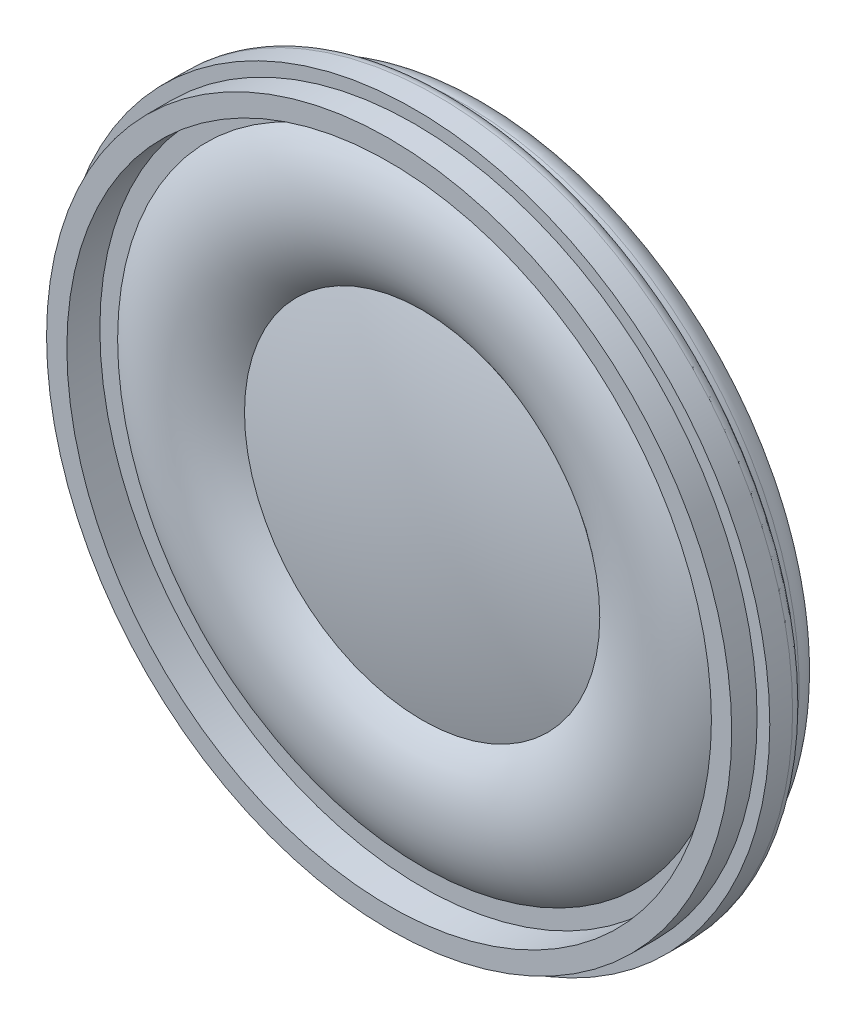
from build123d import *

# Parameters (mm, degrees)
EXTRUDE_2_DEPTH = 0.4
SKETCH_4_W      = 2.615384616
SKETCH_4_H      = 0.512820512
EXTRUDE_3_DEPTH = 0.01


with BuildPart() as part:
    # Эскиз1 → Повернуть2 (revolve)
    with BuildSketch(Plane(origin=(0, 0, 0), x_dir=(1, 0, 0), z_dir=(0, 1, 0))):
        with BuildLine():
            Line((0, 0), (7.5, 0))
            ThreePointArc((7.5, 0), (7.853553391, -0.146446609), (8, -0.5))
            Line((8, -0.5), (8, -1.5))
            Line((8, -1.5), (12.25, -1.5))
            ThreePointArc((12.25, -1.5), (12.957106781, -1.792893219), (13.25, -2.5))
            Line((13.25, -2.5), (13.25, -3))
            Line((13.25, -3), (13.5, -3))
            ThreePointArc((13.5, -3), (13.853553391, -3.146446609), (14, -3.5))
            Line((14, -3.5), (14, -4.4))
            Line((14, -4.4), (13.5, -4.4))
            Line((13.5, -4.4), (13.5, -5.4))
            Line((13.5, -5.4), (12.7, -5.4))
            Line((12.7, -5.4), (12.7, -4.1))
            Line((12.7, -4.1), (12, -4.1))
            ThreePointArc((12, -4.1), (9.5, -5), (7, -4.1))
            ThreePointArc((7, -4.1), (3.528809998, -4.77407776), (0, -5))
            Line((0, -5), (0, 0))
        make_face()
    revolve(axis=Axis((0, 0, 0), (0, 0, 1)))

    # Эскиз2 → Бобышка-Вытянуть2 (add)
    with BuildSketch(Plane(origin=(0, 0, 1.5), x_dir=(-1, 0, 0), z_dir=(0, 0, -1))):
        with BuildLine():
            Line((5.564516129, -6.589900246), (7.5, -8.882039462))
            ThreePointArc((7.5, -8.882039462), (0, -11.625), (-7.5, -8.882039462))
            Line((-7.5, -8.882039462), (-5.564516129, -6.589900246))
            ThreePointArc((-5.564516129, -6.589900246), (0, -8.625), (5.564516129, -6.589900246))
        make_face()
    extrude(amount=EXTRUDE_2_DEPTH)

    # Эскиз4 → Бобышка-Вытянуть3 (add)
    # profile 1 of 6: a face of its own
    with BuildSketch(Plane(origin=(0, 0, 0), x_dir=(-1, 0, 0), z_dir=(0, 0, -1))):
        with BuildLine():
            add(Edge.make_bspline(
                [(-5.763756743, 0.839227754), (-5.800249952, 0.853504104), (-5.870219534, 0.880876601), (-5.964590461, 0.935656672), (-6.044460366, 0.998673929), (-6.108848552, 1.071447993), (-6.157924056, 1.152474424), (-6.193260359, 1.240720139), (-6.213957451, 1.336676764), (-6.216681428, 1.403028298), (-6.218083667, 1.437184485)],
                knots=[0, 0, 0, 0, 1.16287356, 2.229614231, 3.228817875, 4.173350329, 5.100165549, 6.029633206, 6.985702163, 8, 8, 8, 8], degree=3))
            add(Edge.make_bspline(
                [(-6.218083667, 1.437184485), (-6.217423698, 1.463466165), (-6.21612816, 1.515057925), (-6.204934415, 1.590760098), (-6.187006019, 1.663301719), (-6.161561431, 1.732478047), (-6.129683533, 1.798858466), (-6.089459001, 1.861226858), (-6.043223399, 1.921345879), (-5.98906059, 1.976785335), (-5.92937411, 2.027562512), (-5.864724337, 2.072749212), (-5.794616571, 2.109700948), (-5.720219708, 2.140595712), (-5.641165892, 2.164783046), (-5.557176653, 2.181255968), (-5.468548072, 2.191733969), (-5.407817663, 2.193097331), (-5.376737513, 2.193795062)],
                knots=[0, 0, 0, 0, 0.994101948, 1.951453197, 2.889123786, 3.817215529, 4.736003873, 5.669743943, 6.620499649, 7.601567446, 8.596478358, 9.582687259, 10.579761808, 11.589151689, 12.62747492, 13.702346593, 14.8241243, 16, 16, 16, 16], degree=3))
            add(Edge.make_bspline(
                [(-5.376737513, 2.193795062), (-5.345459317, 2.193090247), (-5.284532921, 2.191717346), (-5.195433474, 2.181380129), (-5.110914208, 2.16405431), (-5.031024885, 2.139473334), (-4.955639556, 2.108045076), (-4.885253577, 2.069415622), (-4.819142368, 2.024222094), (-4.758995709, 1.971925543), (-4.704269418, 1.915148495), (-4.656854257, 1.854321059), (-4.616187781, 1.790862602), (-4.58258305, 1.7243876), (-4.557722142, 1.654139079), (-4.53877255, 1.581440555), (-4.527780908, 1.505428227), (-4.526452624, 1.45384595), (-4.525775974, 1.4275691)],
                knots=[0, 0, 0, 0, 1.171211919, 2.281388661, 3.353996503, 4.398126828, 5.406889753, 6.407389155, 7.400009931, 8.40008733, 9.387021643, 10.349004252, 11.283445052, 12.206096336, 13.131640667, 14.068727932, 15.016178647, 16, 16, 16, 16], degree=3))
            add(Edge.make_bspline(
                [(-4.525775974, 1.4275691), (-4.526875171, 1.394590129), (-4.529030489, 1.329924571), (-4.55099414, 1.23670863), (-4.58522637, 1.149686878), (-4.634702272, 1.070517797), (-4.697361661, 0.998383748), (-4.775116966, 0.935676828), (-4.866787332, 0.88098237), (-4.934990292, 0.853520621), (-4.970487513, 0.839227754)],
                knots=[0, 0, 0, 0, 0.998680737, 1.958225066, 2.887911823, 3.823713378, 4.77537694, 5.772726054, 6.840782926, 8, 8, 8, 8], degree=3))
            add(Edge.make_bspline(
                [(-4.970487513, 0.839227754), (-4.948091071, 0.831625223), (-4.904203761, 0.816727561), (-4.842160199, 0.787761915), (-4.783748051, 0.756530073), (-4.728637923, 0.722721585), (-4.678864066, 0.683822194), (-4.632765879, 0.642131861), (-4.590537178, 0.597063086), (-4.552754762, 0.548232554), (-4.519022761, 0.496665136), (-4.49014549, 0.442235107), (-4.465620578, 0.385717208), (-4.444660744, 0.326849354), (-4.429351242, 0.265216888), (-4.418639389, 0.201103042), (-4.41184302, 0.134845721), (-4.410880277, 0.089845194), (-4.410391359, 0.066992177)],
                knots=[0, 0, 0, 0, 1.104208047, 2.163768705, 3.193778962, 4.198696312, 5.179575955, 6.14024585, 7.100368562, 8.060719304, 9.021161243, 9.975749006, 10.935506756, 11.897452199, 12.89163552, 13.897859372, 14.932451246, 16, 16, 16, 16], degree=3))
            add(Edge.make_bspline(
                [(-4.410391359, 0.066992177), (-4.4111557, 0.03549453), (-4.41266151, -0.026558237), (-4.42589203, -0.117644416), (-4.445910392, -0.20514512), (-4.475099475, -0.288690713), (-4.512381187, -0.368340256), (-4.558499115, -0.443978087), (-4.613000135, -0.5155264), (-4.674276562, -0.583207589), (-4.742783571, -0.644388453), (-4.816895464, -0.698302293), (-4.89689032, -0.743462009), (-4.981797526, -0.780854091), (-5.072023649, -0.809832816), (-5.167452708, -0.830124067), (-5.268052947, -0.842206615), (-5.336840275, -0.843835537), (-5.37192982, -0.844666476)],
                knots=[0, 0, 0, 0, 1.017598406, 2.004746413, 2.969099523, 3.915171376, 4.859468899, 5.806714415, 6.772805022, 7.762836953, 8.753334612, 9.736396794, 10.719437652, 11.716790048, 12.730404696, 13.776887535, 14.865953843, 16, 16, 16, 16], degree=3))
            add(Edge.make_bspline(
                [(-5.37192982, -0.844666476), (-5.407015856, -0.843817629), (-5.475796303, -0.842153602), (-5.576488457, -0.830318064), (-5.67178098, -0.809106955), (-5.761889787, -0.780098774), (-5.847303687, -0.743719087), (-5.9267613, -0.697541808), (-6.001357291, -0.643696273), (-6.069911935, -0.582136988), (-6.131697354, -0.514463018), (-6.18547993, -0.441858047), (-6.23132408, -0.365439443), (-6.269052821, -0.284776416), (-6.297810725, -0.199868231), (-6.317993363, -0.111033664), (-6.33124783, -0.018340596), (-6.332717702, 0.044910028), (-6.333468282, 0.077208524)],
                knots=[0, 0, 0, 0, 1.127066097, 2.209429196, 3.250843736, 4.258219581, 5.246860502, 6.227045772, 7.204057202, 8.19754525, 9.181483529, 10.142920909, 11.095356922, 12.039670968, 12.998174893, 13.969127444, 14.962948905, 16, 16, 16, 16], degree=3))
            add(Edge.make_bspline(
                [(-6.333468282, 0.077208524), (-6.332946572, 0.101257157), (-6.331922888, 0.148444738), (-6.325669545, 0.217656077), (-6.313206754, 0.283621759), (-6.297153885, 0.346730518), (-6.276771764, 0.407140235), (-6.251626539, 0.464376512), (-6.221118902, 0.518301017), (-6.186460227, 0.569264632), (-6.147213159, 0.616909574), (-6.104013804, 0.660818607), (-6.056705241, 0.700492295), (-6.006350578, 0.737089387), (-5.950839129, 0.76802111), (-5.892235345, 0.796406729), (-5.829531673, 0.820614399), (-5.785901299, 0.832961165), (-5.763756743, 0.839227754)],
                knots=[0, 0, 0, 0, 1.117345089, 2.192424383, 3.22371675, 4.232639188, 5.215561493, 6.182180952, 7.132172269, 8.089790513, 9.041830748, 9.996006267, 10.94686322, 11.907506267, 12.882866327, 13.894317773, 14.931262935, 16, 16, 16, 16], degree=3))
        make_face()
        with BuildLine():
            add(Edge.make_bspline(
                [(-5.833468282, 1.4353816), (-5.832326748, 1.404763519), (-5.830120798, 1.345595804), (-5.806130852, 1.261552398), (-5.768617539, 1.186057851), (-5.724639763, 1.131310954), (-5.682476121, 1.094009061), (-5.647284754, 1.069103913), (-5.608827396, 1.047959944), (-5.566825441, 1.031525519), (-5.522296177, 1.016965641), (-5.473703854, 1.008827728), (-5.422190606, 1.002212088), (-5.386578295, 1.001732962), (-5.368324051, 1.00148737)],
                knots=[0, 0, 0, 0, 1.528727296, 2.954179336, 4.335216052, 5.725683216, 6.435919001, 7.148062981, 7.879427438, 8.626027458, 9.402978632, 10.2190538, 11.08711833, 12, 12, 12, 12], degree=3))
            add(Edge.make_bspline(
                [(-5.368324051, 1.00148737), (-5.350472753, 1.001742037), (-5.315663699, 1.002238624), (-5.265310651, 1.00871939), (-5.217727196, 1.017375063), (-5.173616478, 1.030491406), (-5.132469241, 1.047546476), (-5.094954727, 1.068571169), (-5.059950322, 1.092734573), (-5.019025291, 1.130321451), (-4.975108203, 1.183150896), (-4.937469174, 1.255272993), (-4.914014133, 1.334178851), (-4.911620151, 1.38914138), (-4.910391359, 1.417352754)],
                knots=[0, 0, 0, 0, 0.922112375, 1.798068639, 2.620552757, 3.419964248, 4.17189205, 4.918165909, 5.639229138, 6.36503528, 7.785020832, 9.165298717, 10.544993853, 12, 12, 12, 12], degree=3))
            add(Edge.make_bspline(
                [(-4.910391359, 1.417352754), (-4.911871881, 1.446550318), (-4.914768879, 1.50368239), (-4.938166626, 1.585698055), (-4.977558783, 1.659979753), (-5.022558862, 1.714226625), (-5.064207855, 1.753525289), (-5.099840691, 1.778541521), (-5.138146124, 1.799832548), (-5.179269943, 1.817219538), (-5.223271615, 1.831242326), (-5.270270336, 1.84044195), (-5.320068617, 1.84689397), (-5.354279008, 1.847386893), (-5.37192982, 1.847641216)],
                knots=[0, 0, 0, 0, 1.480633456, 2.897216237, 4.289382554, 5.720567045, 6.454675042, 7.191244726, 7.924224627, 8.676083236, 9.454506446, 10.26432127, 11.104478565, 12, 12, 12, 12], degree=3))
            add(Edge.make_bspline(
                [(-5.37192982, 1.847641216), (-5.389582597, 1.847395118), (-5.423995822, 1.846915363), (-5.474118823, 1.84026973), (-5.521562951, 1.831922951), (-5.565890502, 1.818527914), (-5.606917222, 1.801023715), (-5.645071636, 1.77972073), (-5.680636958, 1.755343498), (-5.722578563, 1.717797224), (-5.766505486, 1.664966582), (-5.805203869, 1.59399636), (-5.829120722, 1.516614866), (-5.832001145, 1.462794742), (-5.833468282, 1.4353816)],
                knots=[0, 0, 0, 0, 0.914830409, 1.783417199, 2.618873138, 3.411020283, 4.179090249, 4.927874451, 5.674348476, 6.410336976, 7.841713217, 9.213201474, 10.580551314, 12, 12, 12, 12], degree=3))
        make_face(mode=Mode.SUBTRACT)
        with BuildLine():
            add(Edge.make_bspline(
                [(-5.948852897, 0.084420062), (-5.948187811, 0.059741033), (-5.946855885, 0.010317965), (-5.935172032, -0.063085764), (-5.915346953, -0.135122582), (-5.889937663, -0.205860531), (-5.854096279, -0.272444506), (-5.806566573, -0.331875602), (-5.746925695, -0.381841684), (-5.67881255, -0.424054926), (-5.604483598, -0.457280379), (-5.527030655, -0.480472874), (-5.448452744, -0.495797316), (-5.395437289, -0.497607422), (-5.368925013, -0.49851263)],
                knots=[0, 0, 0, 0, 0.957879255, 1.91828174, 2.876792425, 3.856375228, 4.831004356, 5.799187063, 6.79220414, 7.836856316, 8.902268238, 9.943090861, 10.971368942, 12, 12, 12, 12], degree=3))
            add(Edge.make_bspline(
                [(-5.368925013, -0.49851263), (-5.347062782, -0.4981423), (-5.3045907, -0.497422854), (-5.242679703, -0.48920164), (-5.184345546, -0.47672737), (-5.129320975, -0.4596231), (-5.07841589, -0.436223326), (-5.030801322, -0.408874074), (-4.986964308, -0.375820409), (-4.946917257, -0.338097835), (-4.911068047, -0.296369597), (-4.880358665, -0.251353946), (-4.853570509, -0.204316837), (-4.831699204, -0.154243137), (-4.815882725, -0.101029589), (-4.803678078, -0.04563628), (-4.796315376, 0.01250814), (-4.795449276, 0.052147256), (-4.795006743, 0.072400831)],
                knots=[0, 0, 0, 0, 1.149387474, 2.232932207, 3.278773642, 4.285224938, 5.256757121, 6.220082341, 7.168479488, 8.137608443, 9.109140627, 10.056190326, 10.999892409, 11.953252726, 12.923240661, 13.915357002, 14.934853301, 16, 16, 16, 16], degree=3))
            add(Edge.make_bspline(
                [(-4.795006743, 0.072400831), (-4.79546337, 0.09305196), (-4.796357372, 0.133483582), (-4.803532964, 0.192904151), (-4.81642197, 0.249272023), (-4.832997284, 0.30343875), (-4.855461575, 0.354461987), (-4.882426811, 0.403073345), (-4.91544827, 0.447991539), (-4.951658934, 0.490741547), (-4.992637279, 0.529440186), (-5.037890199, 0.562811484), (-5.085983525, 0.592283992), (-5.138372124, 0.614891895), (-5.193901804, 0.63300134), (-5.252836378, 0.646159938), (-5.315416139, 0.654203438), (-5.358282997, 0.654949555), (-5.380343282, 0.655333524)],
                knots=[0, 0, 0, 0, 1.065858887, 2.086781919, 3.082735321, 4.047496077, 5.006086125, 5.955204095, 6.910833714, 7.878747924, 8.844339535, 9.812198509, 10.776903849, 11.749116737, 12.749729282, 13.788304076, 14.861809717, 16, 16, 16, 16], degree=3))
            add(Edge.make_bspline(
                [(-5.380343282, 0.655333524), (-5.401804505, 0.654945734), (-5.443875185, 0.654185545), (-5.504992253, 0.646096481), (-5.56285134, 0.633674362), (-5.616943399, 0.615492938), (-5.667944747, 0.5927734), (-5.714922587, 0.564205207), (-5.758715, 0.531045687), (-5.797984286, 0.492504052), (-5.833415358, 0.450637358), (-5.864049315, 0.40575639), (-5.89111131, 0.358902253), (-5.911648087, 0.308537492), (-5.92903063, 0.256290307), (-5.939897469, 0.201146637), (-5.947622434, 0.143733011), (-5.948436748, 0.104480016), (-5.948852897, 0.084420062)],
                knots=[0, 0, 0, 0, 1.135239447, 2.225422834, 3.256957183, 4.262780498, 5.240265059, 6.205773948, 7.16638056, 8.141101257, 9.111719309, 10.064571387, 11.014055337, 11.969087385, 12.938082716, 13.92369833, 14.938921288, 16, 16, 16, 16], degree=3))
        make_face(mode=Mode.SUBTRACT)
    # profile 2 of 6: a face of its own
    with BuildSketch(Plane(origin=(0, 0, 0), x_dir=(-1, 0, 0), z_dir=(0, 0, -1))):
        with BuildLine():
            add(Edge.make_bspline(
                [(-3.218083667, -0.460051092), (-3.250386324, -0.438167945), (-3.312121174, -0.396346221), (-3.396569694, -0.33093645), (-3.468841781, -0.266118825), (-3.510277416, -0.220790362), (-3.529982705, -0.199233784)],
                knots=[0, 0, 0, 0, 1.147870335, 2.193739119, 3.141007643, 4, 4, 4, 4], degree=3))
            add(Edge.make_bspline(
                [(-3.529982705, -0.199233784), (-3.556542547, -0.166303128), (-3.6099588, -0.100074109), (-3.677594602, 0.009743042), (-3.736007529, 0.127535529), (-3.785337862, 0.253322146), (-3.824501085, 0.386792759), (-3.851735376, 0.527643502), (-3.869147812, 0.675127669), (-3.870990799, 0.775876095), (-3.87192982, 0.827208524)],
                knots=[0, 0, 0, 0, 0.918345753, 1.846945796, 2.794763353, 3.771813116, 4.778497407, 5.812064506, 6.885222846, 8, 8, 8, 8], degree=3))
            add(Edge.make_bspline(
                [(-3.87192982, 0.827208524), (-3.871460331, 0.859671467), (-3.870531766, 0.923877311), (-3.863356098, 1.019225153), (-3.850341538, 1.112388946), (-3.833946275, 1.204027836), (-3.811529571, 1.293455144), (-3.784435379, 1.380930308), (-3.752459843, 1.466368098), (-3.716205559, 1.549668489), (-3.674608436, 1.629424635), (-3.62937392, 1.705408948), (-3.57844846, 1.775776496), (-3.523774077, 1.841786453), (-3.46383941, 1.902395197), (-3.400393553, 1.959121007), (-3.331968149, 2.010461129), (-3.259248024, 2.056531569), (-3.183126284, 2.097819446), (-3.104224996, 2.134325636), (-3.021987153, 2.164012812), (-2.937473011, 2.189615901), (-2.850001253, 2.208548767), (-2.760138335, 2.222653312), (-2.667333105, 2.230247656), (-2.604514193, 2.231580534), (-2.572650974, 2.2322566)],
                knots=[0, 0, 0, 0, 1.084957366, 2.145849849, 3.193091237, 4.227888347, 5.255774708, 6.272259246, 7.287044548, 8.303352674, 9.306520245, 10.291697375, 11.256019279, 12.206694375, 13.153589811, 14.102140702, 15.048846759, 16.009092651, 16.976778816, 17.941472524, 18.911610699, 19.896628563, 20.890796519, 21.900200539, 22.934932669, 24, 24, 24, 24], degree=3))
            add(Edge.make_bspline(
                [(-2.572650974, 2.2322566), (-2.545396885, 2.231959183), (-2.491620951, 2.231372338), (-2.412156781, 2.225252326), (-2.335178408, 2.214899827), (-2.260443174, 2.201346844), (-2.188301323, 2.183084795), (-2.118339886, 2.161626194), (-2.050862625, 2.13574345), (-1.98598569, 2.105512283), (-1.923152835, 2.071958702), (-1.86314327, 2.033876324), (-1.805140197, 1.992402664), (-1.749751584, 1.946585136), (-1.69697277, 1.896593542), (-1.646268289, 1.842951117), (-1.597981241, 1.785222449), (-1.568392407, 1.744067122), (-1.553420205, 1.723242177)],
                knots=[0, 0, 0, 0, 1.100388157, 2.171211883, 3.215711387, 4.235871172, 5.236440253, 6.218927258, 7.189385886, 8.152093313, 9.107568903, 10.063626423, 11.019957669, 11.985244447, 12.963760712, 13.953711893, 14.96456084, 16, 16, 16, 16], degree=3))
            add(Edge.make_bspline(
                [(-1.553420205, 1.723242177), (-1.53259277, 1.691747696), (-1.490944946, 1.628769386), (-1.439027915, 1.52758966), (-1.394348805, 1.422160953), (-1.357576046, 1.311893383), (-1.329300788, 1.196724871), (-1.30985096, 1.076934948), (-1.297409626, 0.952470307), (-1.295817943, 0.867903873), (-1.295006743, 0.824804677)],
                knots=[0, 0, 0, 0, 0.953713572, 1.907104545, 2.869101136, 3.845761926, 4.841656308, 5.862966727, 6.910863184, 8, 8, 8, 8], degree=3))
            add(Edge.make_bspline(
                [(-1.295006743, 0.824804677), (-1.296240137, 0.770255269), (-1.298642449, 0.664007956), (-1.318317435, 0.509545926), (-1.349519576, 0.364385966), (-1.395149487, 0.229496722), (-1.450781093, 0.104244863), (-1.513989949, -0.012160114), (-1.58456726, -0.120093819), (-1.638912852, -0.185100807), (-1.665800013, -0.21726263)],
                knots=[0, 0, 0, 0, 1.157132258, 2.25377685, 3.298521289, 4.302628847, 5.26939645, 6.203329808, 7.111108029, 8, 8, 8, 8], degree=3))
            add(Edge.make_bspline(
                [(-1.665800013, -0.21726263), (-1.683931908, -0.237187247), (-1.722017427, -0.279038324), (-1.788286902, -0.338914612), (-1.864567542, -0.399999722), (-1.920000117, -0.439494152), (-1.948852897, -0.460051092)],
                knots=[0, 0, 0, 0, 0.864352721, 1.815547692, 2.862987658, 4, 4, 4, 4], degree=3))
            Line((-1.948852897, -0.460051092), (-1.218083667, -0.460051092))
            Line((-1.218083667, -0.460051092), (-1.218083667, -0.806204938))
            Line((-1.218083667, -0.806204938), (-2.37192982, -0.806204938))
            Line((-2.37192982, -0.806204938), (-2.37192982, -0.460051092))
            add(Edge.make_bspline(
                [(-2.37192982, -0.460051092), (-2.348168339, -0.446840994), (-2.302689672, -0.421557317), (-2.239710565, -0.382149869), (-2.185017703, -0.343311075), (-2.153188376, -0.315658931), (-2.138155782, -0.302599169)],
                knots=[0, 0, 0, 0, 1.154624259, 2.2099115, 3.154563537, 4, 4, 4, 4], degree=3))
            add(Edge.make_bspline(
                [(-2.138155782, -0.302599169), (-2.115913689, -0.281558681), (-2.071259027, -0.23931644), (-2.011285104, -0.168364056), (-1.95647176, -0.091959178), (-1.907556696, -0.009995825), (-1.86303965, 0.075541173), (-1.824639646, 0.164568906), (-1.792151523, 0.256381149), (-1.765031099, 0.350656383), (-1.743992556, 0.447629931), (-1.729108955, 0.546792704), (-1.719780509, 0.647942779), (-1.718651943, 0.716010624), (-1.718083667, 0.750285447)],
                knots=[0, 0, 0, 0, 0.944807837, 1.896857232, 2.863286351, 3.845619181, 4.841587445, 5.838995316, 6.836786733, 7.847039831, 8.866192015, 9.898474877, 10.941799892, 12, 12, 12, 12], degree=3))
            add(Edge.make_bspline(
                [(-1.718083667, 0.750285447), (-1.719263809, 0.796812979), (-1.721632815, 0.890211907), (-1.740254986, 1.030429114), (-1.771497536, 1.170656528), (-1.805669634, 1.28700336), (-1.839664397, 1.377711303), (-1.868308504, 1.442083032), (-1.900550226, 1.501937676), (-1.935140958, 1.558137704), (-1.973825505, 1.609762204), (-2.015093508, 1.657511285), (-2.060160343, 1.700255636), (-2.107332842, 1.73963781), (-2.158179411, 1.773666869), (-2.211134606, 1.80419881), (-2.267305034, 1.829144398), (-2.325642558, 1.850417919), (-2.386778302, 1.86668488), (-2.450506251, 1.877990405), (-2.516821588, 1.884614605), (-2.561818847, 1.885601547), (-2.584670205, 1.886102754)],
                knots=[0, 0, 0, 0, 1.738390589, 3.489628818, 5.275188123, 7.103639337, 8.015747648, 8.893667832, 9.734315196, 10.554821743, 11.357338521, 12.142559931, 12.91027886, 13.676134081, 14.436075841, 15.193765041, 15.957678649, 16.729656145, 17.512303989, 18.318478645, 19.146058068, 20, 20, 20, 20], degree=3))
            add(Edge.make_bspline(
                [(-2.584670205, 1.886102754), (-2.614956512, 1.885496655), (-2.673955146, 1.884315955), (-2.759930763, 1.872625161), (-2.840478335, 1.853566597), (-2.915990174, 1.827052218), (-2.985983599, 1.792434555), (-3.051330794, 1.751109726), (-3.111046988, 1.701266334), (-3.145808392, 1.662784463), (-3.163396167, 1.643314293)],
                knots=[0, 0, 0, 0, 1.119630171, 2.181073105, 3.201784989, 4.176614547, 5.134201691, 6.083729649, 7.030449673, 8, 8, 8, 8], degree=3))
            add(Edge.make_bspline(
                [(-3.163396167, 1.643314293), (-3.186198952, 1.614074195), (-3.231853772, 1.555530847), (-3.290335773, 1.459989554), (-3.338965798, 1.357640859), (-3.37930775, 1.249287469), (-3.410668089, 1.134438953), (-3.432409862, 1.013156426), (-3.446926233, 0.88545301), (-3.448201068, 0.798003576), (-3.448852897, 0.753290254)],
                knots=[0, 0, 0, 0, 0.932229705, 1.866472867, 2.810839922, 3.778671193, 4.771305902, 5.801178366, 6.87573179, 8, 8, 8, 8], degree=3))
            add(Edge.make_bspline(
                [(-3.448852897, 0.753290254), (-3.448176739, 0.717422129), (-3.446845501, 0.646803981), (-3.439283591, 0.542604406), (-3.425228387, 0.442560434), (-3.406828954, 0.346101954), (-3.382237129, 0.253746028), (-3.351877695, 0.165189563), (-3.317438339, 0.08006289), (-3.27638725, -0.000280152), (-3.230688144, -0.076123394), (-3.180810297, -0.146947545), (-3.127312045, -0.213125448), (-3.068779188, -0.272987806), (-3.006767318, -0.328180538), (-2.940160066, -0.37740662), (-2.869968233, -0.422423618), (-2.820087411, -0.447461665), (-2.795006743, -0.460051092)],
                knots=[0, 0, 0, 0, 1.181479772, 2.326129779, 3.438375264, 4.507189826, 5.558655516, 6.583111951, 7.589044062, 8.580482758, 9.551334481, 10.503190452, 11.431640246, 12.350830639, 13.257648103, 14.162880011, 15.076274334, 16, 16, 16, 16], degree=3))
            Line((-2.795006743, -0.460051092), (-2.795006743, -0.806204938))
            Line((-2.795006743, -0.806204938), (-3.948852897, -0.806204938))
            Line((-3.948852897, -0.806204938), (-3.948852897, -0.460051092))
            Line((-3.948852897, -0.460051092), (-3.218083667, -0.460051092))
        make_face()
    # profile 3 of 6: a face of its own
    with BuildSketch(Plane(origin=(0, 0, 0), x_dir=(-1, 0, 0), z_dir=(0, 0, -1))):
        with BuildLine():
            Line((2.204993257, -0.421589553), (2.204993257, -0.806204938))
            Line((2.204993257, -0.806204938), (0.243454795, -0.806204938))
            add(Edge.make_bspline(
                [(0.243454795, -0.806204938), (0.243414637, -0.783346164), (0.243334456, -0.737705235), (0.251057637, -0.670205195), (0.263153684, -0.6036006), (0.27683068, -0.560889722), (0.283719218, -0.539378015)],
                knots=[0, 0, 0, 0, 1.01057331, 2.01775941, 3.001627217, 4, 4, 4, 4], degree=3))
            add(Edge.make_bspline(
                [(0.283719218, -0.539378015), (0.296446945, -0.504230453), (0.322362694, -0.432664227), (0.374868273, -0.329404158), (0.436627242, -0.226768585), (0.496758292, -0.143208739), (0.551825349, -0.076450263), (0.598006253, -0.024219481), (0.649183162, 0.029244878), (0.705315089, 0.08393305), (0.765861798, 0.140199227), (0.830905906, 0.198231056), (0.901215482, 0.256947048), (0.950298923, 0.295866451), (0.975425949, 0.315790254)],
                knots=[0, 0, 0, 0, 1.204657718, 2.452881516, 3.728232997, 5.065887527, 5.768225529, 6.518857853, 7.313994055, 8.154655305, 9.046094665, 9.979688118, 10.965752482, 12, 12, 12, 12], degree=3))
            add(Edge.make_bspline(
                [(0.975425949, 0.315790254), (1.014027266, 0.348280357), (1.088356552, 0.41084211), (1.193321151, 0.503677953), (1.289189227, 0.589881292), (1.374434189, 0.670963016), (1.449753252, 0.746136685), (1.515323266, 0.815231984), (1.571708415, 0.878033279), (1.618220349, 0.936813713), (1.657463894, 0.992318791), (1.690719333, 1.046460568), (1.718433329, 1.100184781), (1.741515379, 1.153321432), (1.75977132, 1.206097757), (1.77221534, 1.258667518), (1.780654444, 1.310509094), (1.781498784, 1.345005054), (1.781916333, 1.362064293)],
                knots=[0, 0, 0, 0, 1.782554561, 3.432421876, 4.950675607, 6.337395053, 7.588547463, 8.709982106, 9.702713005, 10.569305638, 11.356701089, 12.103210377, 12.812277205, 13.490692607, 14.148717897, 14.782152033, 15.397739362, 16, 16, 16, 16], degree=3))
            add(Edge.make_bspline(
                [(1.781916333, 1.362064293), (1.781498733, 1.378924488), (1.780679425, 1.412003275), (1.772905864, 1.460413872), (1.762084445, 1.507034434), (1.744589504, 1.551025688), (1.723765257, 1.593690386), (1.697053133, 1.633680379), (1.666152698, 1.671992319), (1.630774315, 1.7076161), (1.592132836, 1.741036895), (1.548956489, 1.768817693), (1.504081086, 1.79382869), (1.455958463, 1.813938966), (1.404666816, 1.8287063), (1.350579525, 1.839423582), (1.293705172, 1.846218913), (1.254892425, 1.847159927), (1.235041333, 1.847641216)],
                knots=[0, 0, 0, 0, 0.988194508, 1.938783882, 2.870742509, 3.789494954, 4.709148727, 5.651055405, 6.603531303, 7.592354411, 8.592907906, 9.593461401, 10.59787167, 11.603930315, 12.645063138, 13.723588815, 14.835711238, 16, 16, 16, 16], degree=3))
            add(Edge.make_bspline(
                [(1.235041333, 1.847641216), (1.214188314, 1.84716231), (1.173377423, 1.846225057), (1.113722828, 1.839402625), (1.057091132, 1.828978871), (1.003617503, 1.813041844), (0.953367028, 1.792965103), (0.906544364, 1.767693833), (0.862399686, 1.73916714), (0.82232328, 1.705393688), (0.786082712, 1.667945819), (0.753909524, 1.627176416), (0.727548431, 1.582298717), (0.705778354, 1.53429948), (0.688273389, 1.483027814), (0.67556538, 1.428091758), (0.668636888, 1.369649932), (0.667243626, 1.329628986), (0.666531718, 1.309179677)],
                knots=[0, 0, 0, 0, 1.131143733, 2.213731411, 3.253917892, 4.251203413, 5.236093891, 6.184197493, 7.13373276, 8.082770301, 9.020476205, 9.957489029, 10.893177274, 11.836722509, 12.812818608, 13.827831385, 14.890097571, 16, 16, 16, 16], degree=3))
            Line((0.666531718, 1.309179677), (0.281916333, 1.347641216))
            add(Edge.make_bspline(
                [(0.281916333, 1.347641216), (0.285851495, 1.381161386), (0.293507014, 1.446371993), (0.312575866, 1.540818573), (0.339346809, 1.628680965), (0.371380501, 1.711184155), (0.411537753, 1.786923692), (0.45693207, 1.857466162), (0.510472572, 1.920574253), (0.569620622, 1.978237224), (0.635024251, 2.029053474), (0.706069094, 2.073448523), (0.782722652, 2.110582241), (0.864557992, 2.141327411), (0.951762988, 2.164654545), (1.044214274, 2.181382302), (1.142060527, 2.191693482), (1.209174463, 2.19308454), (1.243454795, 2.193795062)],
                knots=[0, 0, 0, 0, 1.130804643, 2.199883102, 3.223565206, 4.205909148, 5.160801384, 6.091796021, 7.01151579, 7.927798993, 8.855738875, 9.7815393, 10.730299821, 11.705391175, 12.706931101, 13.751121791, 14.851322166, 16, 16, 16, 16], degree=3))
            add(Edge.make_bspline(
                [(1.243454795, 2.193795062), (1.278145443, 2.193201024), (1.34572303, 2.192043834), (1.444194437, 2.180203462), (1.53710493, 2.16176219), (1.624795118, 2.136060702), (1.706746915, 2.102358388), (1.783023359, 2.061181771), (1.853976147, 2.012932515), (1.918419803, 1.957031422), (1.976530332, 1.896006014), (2.027455642, 1.830878748), (2.070031653, 1.761927849), (2.106282482, 1.690093166), (2.133171061, 1.613856879), (2.152079604, 1.534255434), (2.164928508, 1.45122081), (2.16599021, 1.394566096), (2.166531718, 1.365670062)],
                knots=[0, 0, 0, 0, 1.195390245, 2.328627238, 3.413424916, 4.457841177, 5.473507151, 6.462241215, 7.441013641, 8.425227782, 9.397253344, 10.342087291, 11.269524934, 12.186751184, 13.110685745, 14.048630397, 15.004728144, 16, 16, 16, 16], degree=3))
            add(Edge.make_bspline(
                [(2.166531718, 1.365670062), (2.165704844, 1.335982661), (2.164049272, 1.276542345), (2.151127308, 1.187696601), (2.129017683, 1.099815032), (2.099706222, 1.011828065), (2.059660665, 0.923386484), (2.009069904, 0.833270236), (1.946306537, 0.741146438), (1.885945775, 0.662830975), (1.829759702, 0.597182868), (1.779956058, 0.54315064), (1.722336125, 0.485745011), (1.659061441, 0.422977891), (1.587551361, 0.357077018), (1.509860536, 0.286068949), (1.424288277, 0.211822349), (1.364884452, 0.161100636), (1.334199987, 0.134900831)],
                knots=[0, 0, 0, 0, 0.927118007, 1.856282007, 2.79721255, 3.754929441, 4.749232485, 5.824981375, 6.979078785, 8.228161913, 8.911614355, 9.677694854, 10.522803217, 11.452009355, 12.461436787, 13.560019032, 14.739651695, 16, 16, 16, 16], degree=3))
            add(Edge.make_bspline(
                [(1.334199987, 0.134900831), (1.307923378, 0.11350887), (1.257817928, 0.072717693), (1.18653322, 0.013581631), (1.122683802, -0.040644536), (1.064776568, -0.088192053), (1.01492046, -0.131360734), (0.971359368, -0.168259978), (0.935675888, -0.200745066), (0.881336267, -0.250090571), (0.8125105, -0.320427601), (0.761796732, -0.388772128), (0.73744518, -0.421589553)],
                knots=[0, 0, 0, 0, 1.241996727, 2.368296581, 3.394949853, 4.3125351, 5.114548721, 5.812230366, 6.404953749, 6.883082049, 8.503329734, 10, 10, 10, 10], degree=3))
            Line((0.73744518, -0.421589553), (2.204993257, -0.421589553))
        make_face()
    # profile 4 of 6: a face of its own
    with BuildSketch(Plane(origin=(0, 0, 0), x_dir=(-1, 0, 0), z_dir=(0, 0, -1))):
        with BuildLine():
            Line((3.22963268, -0.806204938), (2.474224026, 2.193795062))
            Line((2.474224026, 2.193795062), (2.911123064, 2.193795062))
            Line((2.911123064, 2.193795062), (3.356435564, 0.220838331))
            add(Edge.make_bspline(
                [(3.356435564, 0.220838331), (3.379514428, 0.119084983), (3.425436538, -0.083382894), (3.470859728, -0.285963286), (3.493454795, -0.386733784)],
                knots=[0, 0, 0, 0, 1.00513078, 2, 2, 2, 2], degree=3))
            add(Edge.make_bspline(
                [(3.493454795, -0.386733784), (3.50415285, -0.350499207), (3.524348829, -0.282094928), (3.551649878, -0.185125271), (3.576446547, -0.100492851), (3.597572035, -0.027803124), (3.614677262, 0.033046035), (3.629445721, 0.081306915), (3.639511717, 0.11792462), (3.645476845, 0.138112082), (3.64790191, 0.1463191)],
                knots=[0, 0, 0, 0, 1.633809233, 3.084334118, 4.356383392, 5.447555203, 6.357852567, 7.089694452, 7.629924063, 8, 8, 8, 8], degree=3))
            Line((3.64790191, 0.1463191), (4.240449987, 2.193795062))
            Line((4.240449987, 2.193795062), (4.74946441, 2.193795062))
            Line((4.74946441, 2.193795062), (5.177949987, 0.690790254))
            add(Edge.make_bspline(
                [(5.177949987, 0.690790254), (5.201596425, 0.597940512), (5.248222081, 0.414860915), (5.310171791, 0.142157073), (5.367349394, -0.123930918), (5.400284767, -0.299919153), (5.416531718, -0.386733784)],
                knots=[0, 0, 0, 0, 1.04154457, 2.053700482, 3.039894486, 4, 4, 4, 4], degree=3))
            add(Edge.make_bspline(
                [(5.416531718, -0.386733784), (5.426492366, -0.342250098), (5.447453561, -0.248638593), (5.481681962, -0.101222583), (5.517106916, 0.06086885), (5.542654855, 0.173580376), (5.555954795, 0.2322566)],
                knots=[0, 0, 0, 0, 0.862130727, 1.814268567, 2.86213528, 4, 4, 4, 4], degree=3))
            Line((5.555954795, 0.2322566), (5.998863449, 2.193795062))
            Line((5.998863449, 2.193795062), (6.435762487, 2.193795062))
            Line((6.435762487, 2.193795062), (5.679752872, -0.806204938))
            Line((5.679752872, -0.806204938), (5.214608641, -0.806204938))
            Line((5.214608641, -0.806204938), (4.587805757, 1.486463331))
            add(Edge.make_bspline(
                [(4.587805757, 1.486463331), (4.581511753, 1.508876294), (4.569555489, 1.551452578), (4.553883628, 1.612210379), (4.538342316, 1.665644364), (4.525980735, 1.712445082), (4.515282821, 1.752140926), (4.505809361, 1.784615672), (4.499716286, 1.810504905), (4.495310058, 1.825219575), (4.493454795, 1.831415254)],
                knots=[0, 0, 0, 0, 1.562239628, 2.967673567, 4.210417925, 5.296319877, 6.215971374, 6.969386481, 7.566055473, 8, 8, 8, 8], degree=3))
            add(Edge.make_bspline(
                [(4.493454795, 1.831415254), (4.482330737, 1.792125248), (4.461311733, 1.717886444), (4.430183561, 1.613373747), (4.404063753, 1.521475409), (4.387511033, 1.464620933), (4.379873064, 1.438386408)],
                knots=[0, 0, 0, 0, 1.197730334, 2.263121701, 3.198547257, 4, 4, 4, 4], degree=3))
            Line((4.379873064, 1.438386408), (3.730233641, -0.806204938))
            Line((3.730233641, -0.806204938), (3.22963268, -0.806204938))
        make_face()
    # profile 5 of 6: a face of its own
    with BuildSketch(Plane(origin=(0, 0, 0), x_dir=(-1, 0, 0), z_dir=(0, 0, -1))):
        with Locations((-3.009476426, -3.670384727)):
            Rectangle(SKETCH_4_W, SKETCH_4_H)
    # profile 6 of 6: a face of its own
    with BuildSketch(Plane(origin=(0, 0, 0), x_dir=(-1, 0, 0), z_dir=(0, 0, -1))):
        Polygon((3.067446651, -5.00371806), (3.067446651, -3.926794983), (1.990523574, -3.926794983), (1.990523574, -3.465256522), (3.067446651, -3.465256522), (3.067446651, -2.388333445), (3.528985113, -2.388333445), (3.528985113, -3.465256522), (4.605908189, -3.465256522), (4.605908189, -3.926794983), (3.528985113, -3.926794983), (3.528985113, -5.00371806), align=None)
    extrude(amount=EXTRUDE_3_DEPTH)


solid = part.part
